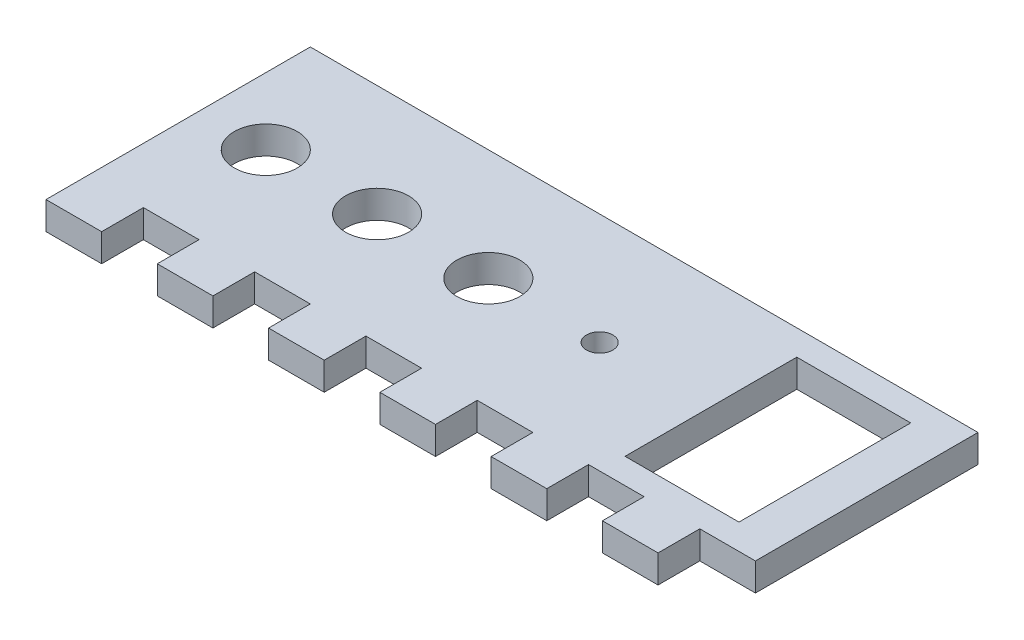
from build123d import *

# Parameters (mm, degrees)
SKETCH1_R           = 3.6
SKETCH1_R_2         = 1.5
SKETCH1_W           = 13
SKETCH1_H           = 19.6
BOSS_EXTRUDE1_DEPTH = 3.175


with BuildPart() as part:
    # Sketch1 → Boss-Extrude1 (new body)
    with BuildSketch(Plane(origin=(0, 0, 0), x_dir=(1, 0, 0), z_dir=(0, 1, 0))):
        Polygon((0, 0), (0, -4.7625), (6.35, -4.7625), (6.35, 0), (12.7, 0), (12.7, -4.7625), (19.05, -4.7625), (19.05, 0), (25.4, 0), (25.4, -4.7625), (31.75, -4.7625), (31.75, 0), (38.1, 0), (38.1, -4.7625), (44.45, -4.7625), (44.45, 0), (50.8, 0), (50.8, -4.7625), (57.15, -4.7625), (57.15, 0), (63.5, 0), (63.5, -4.7625), (69.85, -4.7625), (69.85, 0), (76.2, 0), (76.2, 25.4), (0, 25.4), align=None)
        with Locations((7.62, 12.7)):
            Circle(SKETCH1_R, mode=Mode.SUBTRACT)
        with Locations((20.32, 12.7)):
            Circle(SKETCH1_R, mode=Mode.SUBTRACT)
        with Locations((33.02, 12.7)):
            Circle(SKETCH1_R, mode=Mode.SUBTRACT)
        with Locations((45.72, 12.7)):
            Circle(SKETCH1_R_2, mode=Mode.SUBTRACT)
        with Locations((64.92, 12.7)):
            Rectangle(SKETCH1_W, SKETCH1_H, mode=Mode.SUBTRACT)
    extrude(amount=BOSS_EXTRUDE1_DEPTH)


solid = part.part
